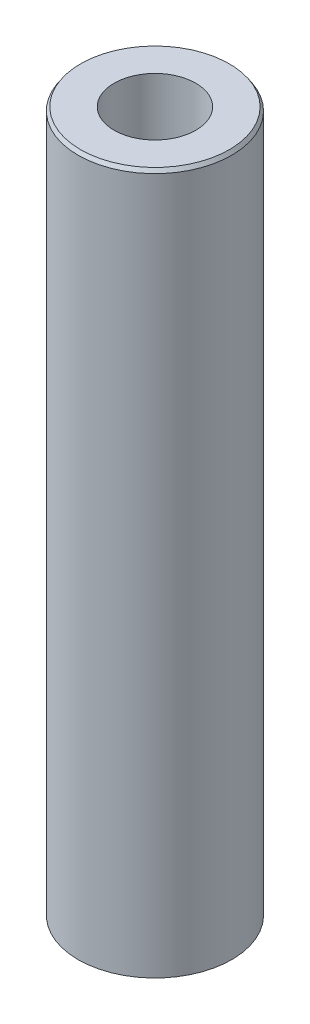
from build123d import *
from OCP.BRepFilletAPI import BRepFilletAPI_MakeChamfer

# Parameters (mm, degrees)
SKETCH1_R           = 55
BOSS_EXTRUDE1_DEPTH = 503.185772735
SKETCH2_R           = 29.235943879
CUT_EXTRUDE1_DEPTH  = 510.161980006
CHAMFER1_SIZE       = 2.614288271
CHAMFER1_SIZE2      = 1.734489846


with BuildPart() as part:
    # Sketch1 → Boss-Extrude1 (new body)
    with BuildSketch(Plane(origin=(0, 0, 0), x_dir=(1, 0, 0), z_dir=(0, 1, 0))):
        Circle(SKETCH1_R)
    extrude(amount=BOSS_EXTRUDE1_DEPTH)

    # Sketch2 → Cut-Extrude1 (cut, through all)
    with BuildSketch(Plane(origin=(0, 0, 0), x_dir=(1, 0, 0), z_dir=(0, 1, 0))):
        Circle(SKETCH2_R)
    extrude(amount=CUT_EXTRUDE1_DEPTH, mode=Mode.SUBTRACT)

    # Chamfer1: one chamfer whose edges measure the first distance from different faces: ONE call of the kernel's chamfer builder (chamfer() names one face for all edges)
    chamfer1_edges_1 = [part.edges().sort_by_distance(p)[0] for p in [
        (-55, 503.185772735, 0),
    ]]
    chamfer1_side_1 = [part.faces().sort_by_distance(p)[0] for p in [
        (-55, 251.592886368, 0),
    ]]
    chamfer1_edges_2 = [part.edges().sort_by_distance(p)[0] for p in [
        (-55, 0, 0),
    ]]
    chamfer1_side_2 = [part.faces().sort_by_distance(p)[0] for p in [
        (-53.444365081, 0, 0),
    ]]
    chamfer1 = BRepFilletAPI_MakeChamfer(part.part.solid().wrapped)
    for e in chamfer1_edges_1:
        chamfer1.Add(CHAMFER1_SIZE, CHAMFER1_SIZE2, e.wrapped, chamfer1_side_1[0].wrapped)  # the first distance lies on this face
    for e in chamfer1_edges_2:
        chamfer1.Add(CHAMFER1_SIZE, CHAMFER1_SIZE2, e.wrapped, chamfer1_side_2[0].wrapped)  # the first distance lies on this face
    add(Compound.cast(chamfer1.Shape()), mode=Mode.REPLACE)


solid = part.part
